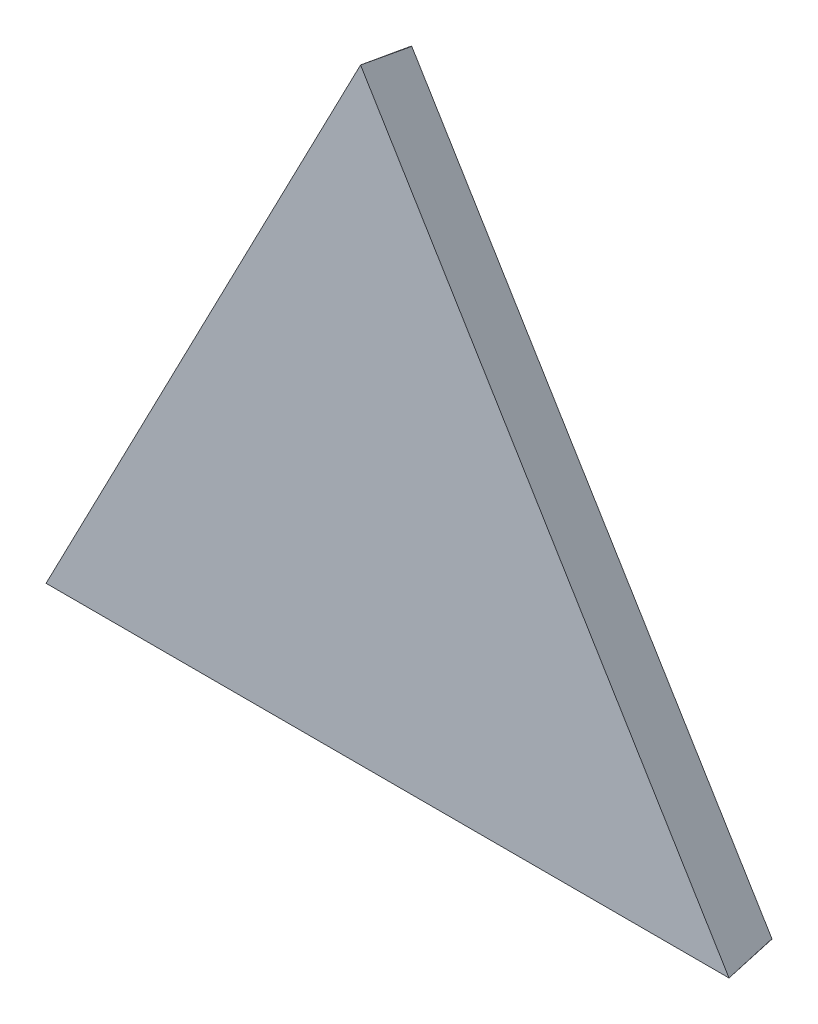
from build123d import *

# Parameters (mm, degrees)
BOSS_EXTRUDE1_DEPTH = 70
CHAMFER1_SIZE2      = 5.656659752
CHAMFER1_SIZE       = 70
CHAMFER2_SIZE2      = 5.656659752
CHAMFER2_SIZE       = 70
CHAMFER3_SIZE2      = 6.345862846
CHAMFER3_SIZE       = 70
SKETCH3_W           = 71.265106757
SKETCH3_H           = 1.348372647
CUT_EXTRUDE1_DEPTH  = 10
SKETCH4_W           = 97.217574519
SKETCH4_H           = 25.906089707
CUT_EXTRUDE2_DEPTH  = 10
CUT_EXTRUDE3_DEPTH  = 15


with BuildPart() as part:
    # Sketch1 → Boss-Extrude1 (new body)
    with BuildSketch(Plane(origin=(-0.957874252, -0.581996614, 1948.924528972), x_dir=(0.9999998792194947, -1.4677051691166262e-07, 0.0004914885295678381), z_dir=(-0.0004914885514824738, -0.00029862445089364614, 0.999999834631207))):
        Polygon((-1508.366336361, 624.783470122), (-1940.821133222, -208.262480206), (-1002.214342981, -208.262411326), align=None)
    extrude(amount=-BOSS_EXTRUDE1_DEPTH)

    # Chamfer1
    chamfer1_edges = [part.edges().sort_by_distance(p)[0] for p in [
        (-1725.516996548, 207.69964589, 1878.139114193),
    ]]
    chamfer1_side = [part.faces().sort_by_distance(p)[0] for p in [
        (-1725.517052151, 207.699612105, 1878.252247369),
    ]]
    chamfer(chamfer1_edges, length=CHAMFER1_SIZE - 0.0001, length2=CHAMFER1_SIZE2 - 0.0001, reference=chamfer1_side[0])  # a hair under: the kernel refuses the full size

    # Chamfer2
    chamfer2_edges = [part.edges().sort_by_distance(p)[0] for p in [
        (-1469.254360498, -208.82331364, 1878.140680405),
    ]]
    chamfer2_side = [part.faces().sort_by_distance(p)[0] for p in [
        (-1469.254416102, -208.823347425, 1878.253813581),
    ]]
    chamfer(chamfer2_edges, length=CHAMFER2_SIZE - 0.0001, length2=CHAMFER2_SIZE2 - 0.0001, reference=chamfer2_side[0])  # a hair under: the kernel refuses the full size

    # Chamfer3
    chamfer3_edges = [part.edges().sort_by_distance(p)[0] for p in [
        (-1256.21365811, 207.69961145, 1878.369771439),
    ]]
    chamfer3_side = [part.faces().sort_by_distance(p)[0] for p in [
        (-1256.213720488, 207.699573549, 1878.496688675),
    ]]
    chamfer(chamfer3_edges, length=CHAMFER3_SIZE - 0.0001, length2=CHAMFER3_SIZE2 - 0.0001, reference=chamfer3_side[0])  # a hair under: the kernel refuses the full size

    # Sketch3 → Cut-Extrude1 (cut)
    with BuildSketch(Plane(origin=(-1471.025902014, 77.181437246, -1001.088177066), x_dir=(-0.012766042139118148, 0.1823400765961239, 0.9831526456430975), z_dir=(0.4685062593771071, 0.8697178350344407, -0.1552184665156707))):
        with Locations((2964.367143604, -0.674186324)):
            Rectangle(SKETCH3_W, SKETCH3_H)
    extrude(amount=CUT_EXTRUDE1_DEPTH, mode=Mode.SUBTRACT)

    # Sketch4 → Cut-Extrude2 (cut)
    with BuildSketch(Plane(origin=(-1471.025902014, 77.181437246, -1001.088177066), x_dir=(0.15595126860972144, -0.09534189626809239, 0.9831526456430979), z_dir=(-0.9877647491052985, -0.015100598579889693, 0.155218466515669))):
        with Locations((2960.985531457, 3.24314791)):
            Rectangle(SKETCH4_W, SKETCH4_H)
    extrude(amount=-CUT_EXTRUDE2_DEPTH, mode=Mode.SUBTRACT)

    # 3DSketch1 → Cut-Extrude3 (cut, along a direction that is not the sketch's normal)
    with BuildSketch(Plane(origin=(-1931.280839181, -200.944485541, 1877.915952454), x_dir=(-0.14741205849129177, -0.11092760059742722, 0.9828350586121039), z_dir=(0.8400877812574963, 0.510430510798338, 0.18361158304422126))):
        Polygon((0, 0), (0.047467536, 2.599718778), (71.214892371, 0), align=None)
    extrude(amount=-CUT_EXTRUDE3_DEPTH, dir=(-0.0004914885514824738, -0.0002986244508937508, 0.9999998346312069), mode=Mode.SUBTRACT)


solid = part.part
